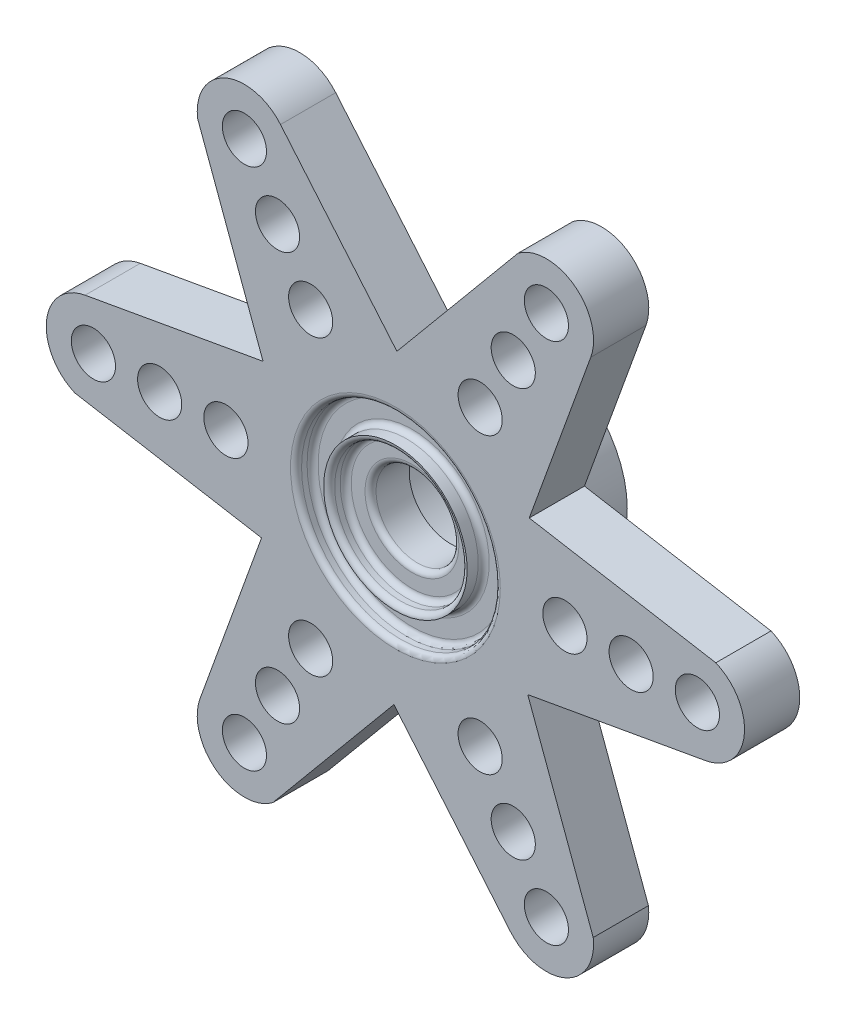
from build123d import *

# Parameters (mm, degrees)
SKETCH1_R           = 1
SKETCH1_R_2         = 1.875
BOSS_EXTRUDE1_DEPTH = 2.5
CUT_EXTRUDE1_START  = -0.75
SKETCH2_R           = 4.5
SKETCH2_R_2         = 3.25
SKETCH2_R_3         = 3
SKETCH2_R_4         = 1.875
CUT_EXTRUDE1_DEPTH  = 0.75
FILLET2_R           = 0.25
BOSS_EXTRUDE2_START = 3.5
SKETCH3_R           = 4.5
SKETCH3_R_2         = 3.625
BOSS_EXTRUDE2_DEPTH = 3.5


with BuildPart() as part:
    # Sketch1 → Boss-Extrude1 (new body)
    with BuildSketch(Plane.XY):
        with BuildLine():
            Line((7.901303318, 3.104128113), (14.510390044, 1.96637153))
            ThreePointArc((14.510390044, 1.96637153), (15.797911049, -0.240296062), (14.049731359, -2.103347315))
            Line((14.049731359, -2.103347315), (6.789333322, -3.396856383))
            Line((6.789333322, -3.396856383), (5.993186864, -3.538697458))
            Line((5.993186864, -3.538697458), (6.638905462, -5.29066534))
            Line((6.638905462, -5.29066534), (8.95812272, -11.583180632))
            ThreePointArc((8.95812272, -11.583180632), (7.69085303, -13.801540326), (5.203313472, -13.219097931))
            Line((5.203313472, -13.219097931), (0.45290274, -7.578163323))
            Line((0.45290274, -7.578163323), (-0.068008463, -6.959600803))
            Line((-0.068008463, -6.959600803), (-1.262397857, -8.394793453))
            Line((-1.262397857, -8.394793453), (-5.552267324, -13.549552162))
            ThreePointArc((-5.552267324, -13.549552162), (-8.107058019, -13.561244264), (-8.846417887, -11.115750616))
            Line((-8.846417887, -11.115750616), (-6.336430581, -4.18130694))
            Line((-6.336430581, -4.18130694), (-6.061195327, -3.420903345))
            Line((-6.061195327, -3.420903345), (-7.901303318, -3.104128113))
            Line((-7.901303318, -3.104128113), (-14.510390044, -1.96637153))
            ThreePointArc((-14.510390044, -1.96637153), (-15.797911049, 0.240296062), (-14.049731359, 2.103347315))
            Line((-14.049731359, 2.103347315), (-6.789333322, 3.396856383))
            Line((-6.789333322, 3.396856383), (-5.993186864, 3.538697458))
            Line((-5.993186864, 3.538697458), (-6.638905462, 5.29066534))
            Line((-6.638905462, 5.29066534), (-8.95812272, 11.583180632))
            ThreePointArc((-8.95812272, 11.583180632), (-7.69085303, 13.801540326), (-5.203313472, 13.219097931))
            Line((-5.203313472, 13.219097931), (-0.45290274, 7.578163323))
            Line((-0.45290274, 7.578163323), (0.068008463, 6.959600803))
            Line((0.068008463, 6.959600803), (1.262397857, 8.394793453))
            Line((1.262397857, 8.394793453), (5.552267324, 13.549552162))
            ThreePointArc((5.552267324, 13.549552162), (8.107058019, 13.561244264), (8.846417887, 11.115750616))
            Line((8.846417887, 11.115750616), (6.336430581, 4.18130694))
            Line((6.336430581, 4.18130694), (6.061195327, 3.420903345))
            Line((6.061195327, 3.420903345), (7.901303318, 3.104128113))
        make_face()
        with Locations((7.675, 0)):
            Circle(SKETCH1_R, mode=Mode.SUBTRACT)
        with Locations((10.675, 0)):
            Circle(SKETCH1_R, mode=Mode.SUBTRACT)
        with Locations((13.675, 0)):
            Circle(SKETCH1_R, mode=Mode.SUBTRACT)
        with Locations((3.8375, -6.646744974)):
            Circle(SKETCH1_R, mode=Mode.SUBTRACT)
        with Locations((5.3375, -9.244821185)):
            Circle(SKETCH1_R, mode=Mode.SUBTRACT)
        with Locations((6.8375, -11.842897397)):
            Circle(SKETCH1_R, mode=Mode.SUBTRACT)
        with Locations((-3.8375, -6.646744974)):
            Circle(SKETCH1_R, mode=Mode.SUBTRACT)
        with Locations((-5.3375, -9.244821185)):
            Circle(SKETCH1_R, mode=Mode.SUBTRACT)
        with Locations((-6.8375, -11.842897397)):
            Circle(SKETCH1_R, mode=Mode.SUBTRACT)
        with Locations((-7.675, 0)):
            Circle(SKETCH1_R, mode=Mode.SUBTRACT)
        with Locations((-10.675, 0)):
            Circle(SKETCH1_R, mode=Mode.SUBTRACT)
        with Locations((-13.675, 0)):
            Circle(SKETCH1_R, mode=Mode.SUBTRACT)
        with Locations((-3.8375, 6.646744974)):
            Circle(SKETCH1_R, mode=Mode.SUBTRACT)
        with Locations((-5.3375, 9.244821185)):
            Circle(SKETCH1_R, mode=Mode.SUBTRACT)
        with Locations((-6.8375, 11.842897397)):
            Circle(SKETCH1_R, mode=Mode.SUBTRACT)
        with Locations((3.8375, 6.646744974)):
            Circle(SKETCH1_R, mode=Mode.SUBTRACT)
        with Locations((5.3375, 9.244821185)):
            Circle(SKETCH1_R, mode=Mode.SUBTRACT)
        with Locations((6.8375, 11.842897397)):
            Circle(SKETCH1_R, mode=Mode.SUBTRACT)
        Circle(SKETCH1_R_2, mode=Mode.SUBTRACT)
    extrude(amount=BOSS_EXTRUDE1_DEPTH)

    # Sketch2 → Cut-Extrude1 (cut)
    # profile 1 of 2: a face of its own
    with BuildSketch(Plane.XY.offset(2.5).offset(CUT_EXTRUDE1_START)):
        Circle(SKETCH2_R)
        Circle(SKETCH2_R_2, mode=Mode.SUBTRACT)
    # profile 2 of 2: a face of its own
    with BuildSketch(Plane.XY.offset(2.5).offset(CUT_EXTRUDE1_START)):
        Circle(SKETCH2_R_3)
        Circle(SKETCH2_R_4, mode=Mode.SUBTRACT)
    extrude(amount=CUT_EXTRUDE1_DEPTH, mode=Mode.SUBTRACT)

    # Fillet2
    fillet2_edges = [part.edges().sort_by_distance(p)[0] for p in [
        (-1.875, 0, 1.75),
        (-3, 0, 1.75),
        (-3, 0, 2.5),
        (-4.5, 0, 1.75),
        (-3.25, 0, 1.75),
        (-4.5, 0, 2.5),
    ]]
    fillet(fillet2_edges, radius=FILLET2_R - 0.0001)  # a hair under: the kernel refuses the full size

    # Sketch3 → Boss-Extrude2 (add)
    with BuildSketch(Plane(origin=(0, 0, 0), x_dir=(-1, 0, 0), z_dir=(0, 0, -1)).offset(BOSS_EXTRUDE2_START)):
        with Locations(Location((0, 0, 0), (0, 0, 180))):
            Circle(SKETCH3_R)
        Circle(SKETCH3_R_2, mode=Mode.SUBTRACT)
    extrude(amount=-BOSS_EXTRUDE2_DEPTH)


solid = part.part
